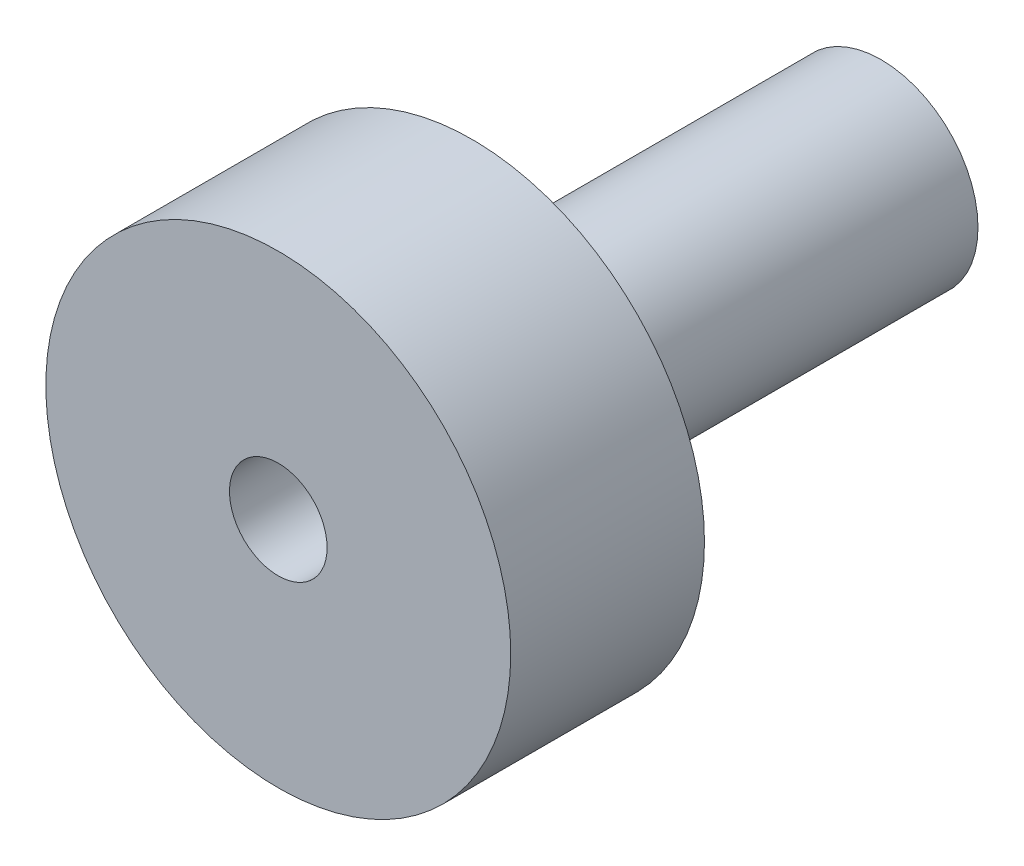
from build123d import *

# Parameters (mm, degrees)
SKETCH1_R           = 9.525
SKETCH1_R_2         = 2
BOSS_EXTRUDE1_DEPTH = 7.9375
SKETCH2_R           = 3.96875
BOSS_EXTRUDE2_DEPTH = 16.764
SKETCH3_R           = 2
CUT_EXTRUDE1_DEPTH  = 29.135659798


with BuildPart() as part:
    # Sketch1 → Boss-Extrude1 (new body)
    with BuildSketch(Plane.XY):
        Circle(SKETCH1_R)
        Circle(SKETCH1_R_2, mode=Mode.SUBTRACT)
    extrude(amount=BOSS_EXTRUDE1_DEPTH)

    # Sketch2 → Boss-Extrude2 (add)
    with BuildSketch(Plane(origin=(0, 0, 0), x_dir=(-1, 0, 0), z_dir=(0, 0, -1))):
        Circle(SKETCH2_R)
    extrude(amount=BOSS_EXTRUDE2_DEPTH)

    # Sketch3 → Cut-Extrude1 (cut, through all)
    with BuildSketch(Plane.XY.offset(7.9375)):
        Circle(SKETCH3_R)
    extrude(amount=-CUT_EXTRUDE1_DEPTH, mode=Mode.SUBTRACT)


solid = part.part
